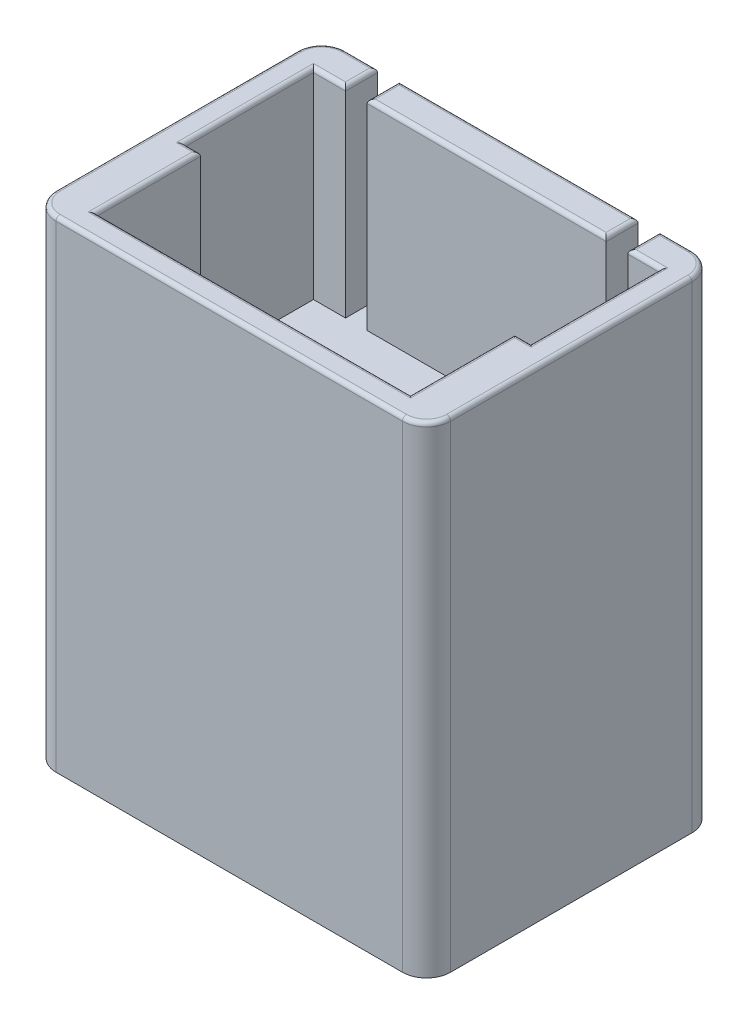
from build123d import *

# Parameters (mm, degrees)
EXTRUDE_1_DEPTH      = 25
SKETCH_1_W           = 29.8
SKETCH_1_H           = 4
EXTRUDE_1_2_DEPTH    = 25
SKETCH_2_W           = 49.2
SKETCH_2_H           = 36.1
EXTRUDE_2_DEPTH      = 5
SKETCH_4_W           = 6
SKETCH_4_H           = 6
CUT_EXTRUDE_1_DEPTH  = 1.5
SKETCH_5_W           = 6
SKETCH_5_H           = 13
CUT_EXTRUDE_2_DEPTH  = 5.5
SKETCH_6_W           = 20
SKETCH_6_H           = 10
CUT_EXTRUDE_3_DEPTH  = 5.5
SKETCH_11_W          = 6.036428748
SKETCH_11_H          = 14.5
CUT_EXTRUDE_10_DEPTH = 38
SKETCH_12_W          = 49.2
SKETCH_12_H          = 36.1
SKETCH_12_W_2        = 6.036428748
SKETCH_12_H_2        = 14.5
SKETCH_12_W_3        = 20
SKETCH_12_H_3        = 10
EXTRUDE_3_DEPTH      = 30
SKETCH_13_W          = 20
SKETCH_13_H          = 3
EXTRUDE_4_DEPTH      = 3
SKETCH_14_W          = 8
SKETCH_14_H          = 7.841140532
CUT_EXTRUDE_11_DEPTH = 20
FILLET_1_R           = 3
FILLET_2_R           = 0.5


with BuildPart() as part:
    # 草图1 → 凸台-拉伸1 (new body)
    with BuildSketch(Plane(origin=(0, 0, 0), x_dir=(1, 0, 0), z_dir=(0, 1, 0))):
        Polygon((-21.6, -8.1), (-21.6, 8), (-17.6, 8), (-17.6, 12), (-24.6, 12), (-24.6, -24.1), (24.6, -24.1), (24.6, 12), (17.6, 12), (17.6, 8), (21.6, 8), (21.6, -8.1), (19.6, -8.1), (19.6, -21.1), (-19.6, -21.1), (-19.6, -8.1), align=None)
    extrude(amount=EXTRUDE_1_DEPTH)



with BuildPart() as body_2:
    # 草图1 → Extrude 1 2 (new body)
    with BuildSketch(Plane(origin=(0, 0, 0), x_dir=(1, 0, 0), z_dir=(0, 1, 0))):
        with Locations((0, 10)):
            Rectangle(SKETCH_1_W, SKETCH_1_H)
    extrude(amount=EXTRUDE_1_2_DEPTH)


with BuildPart() as part_1:
    add(part.part)

    add(body_2.part)  # 凸台-拉伸2 merges body 2
    # 草图2 → 凸台-拉伸2 (add)
    with BuildSketch(Plane.XZ):
        with Locations((0, 6.05)):
            Rectangle(SKETCH_2_W, SKETCH_2_H)
    extrude(amount=EXTRUDE_2_DEPTH)

    # 草图4 → 切除-拉伸1 (cut)
    with BuildSketch(Plane(origin=(0, 0, 21.1), x_dir=(-1, 0, 0), z_dir=(0, 0, -1))):
        with Locations((-0.080282045, 3)):
            Rectangle(SKETCH_4_W, SKETCH_4_H)
    extrude(amount=-CUT_EXTRUDE_1_DEPTH, mode=Mode.SUBTRACT)

    # 草图5 → 切除-拉伸2 (cut)
    with BuildSketch(Plane(origin=(0, 0, 0), x_dir=(1, 0, 0), z_dir=(0, 1, 0))):
        with Locations((0.080282045, -14.6)):
            Rectangle(SKETCH_5_W, SKETCH_5_H)
    extrude(amount=-CUT_EXTRUDE_2_DEPTH, mode=Mode.SUBTRACT)

    # 草图6 → 切除-拉伸3 (cut)
    with BuildSketch(Plane(origin=(0, 0, 0), x_dir=(1, 0, 0), z_dir=(0, 1, 0))):
        with Locations((9.6, -0.585397149)):
            Rectangle(SKETCH_6_W, SKETCH_6_H)
    extrude(amount=-CUT_EXTRUDE_3_DEPTH, mode=Mode.SUBTRACT)

    # 草图11 → 切除-拉伸10 (cut)
    with BuildSketch(Plane(origin=(0, 0, 0), x_dir=(1, 0, 0), z_dir=(0, 1, 0))):
        with Locations((0.098496419, -15.35)):
            Rectangle(SKETCH_11_W, SKETCH_11_H)
    extrude(amount=-CUT_EXTRUDE_10_DEPTH, mode=Mode.SUBTRACT)

    # 草图12 → 凸台-拉伸3 (add)
    with BuildSketch(Plane.XZ.offset(5)):
        with Locations((0, 6.05)):
            Rectangle(SKETCH_12_W, SKETCH_12_H)
        with Locations((0.098496419, 15.35)):
            Rectangle(SKETCH_12_W_2, SKETCH_12_H_2, mode=Mode.SUBTRACT)
        with Locations((9.6, 0.585397149)):
            Rectangle(SKETCH_12_W_3, SKETCH_12_H_3, mode=Mode.SUBTRACT)
    extrude(amount=EXTRUDE_3_DEPTH)

    # 草图13 → 凸台-拉伸4 (add)
    with BuildSketch(Plane.XZ.offset(35)):
        with Locations((9.6, -2.914602851)):
            Rectangle(SKETCH_13_W, SKETCH_13_H)
    extrude(amount=-EXTRUDE_4_DEPTH)

    # 草图14 → 切除-拉伸11 (cut)
    with BuildSketch(Plane.XZ.offset(35)):
        Rectangle(SKETCH_14_W, SKETCH_14_H)
    extrude(amount=-CUT_EXTRUDE_11_DEPTH, mode=Mode.SUBTRACT)

    # 圆角1
    fillet_1_edges = [part_1.edges().sort_by_distance(p)[0] for p in [
        (24.6, -5, -12),
        (24.6, -5, 24.1),
        (-24.6, -5, 24.1),
        (-24.6, -5, -12),
    ]]
    fillet(fillet_1_edges, radius=FILLET_1_R)

    # 圆角2
    fillet_2_edges = [part_1.edges().sort_by_distance(p)[0] for p in [
        (23.721320344, 25, 23.221320344),
        (0, 25, 24.1),
        (-23.721320344, 25, 23.221320344),
        (-24.6, 25, 6.05),
        (-23.721320344, 25, -11.121320344),
        (-19.6, 25, -12),
        (-17.6, 25, -10),
        (-19.6, 25, -8),
        (-21.6, 25, 0.05),
        (-20.6, 25, 8.1),
        (-19.6, 25, 14.6),
        (0, 25, 21.1),
        (19.6, 25, 14.6),
        (20.6, 25, 8.1),
        (21.6, 25, 0.05),
        (19.6, 25, -8),
        (17.6, 25, -10),
        (19.6, 25, -12),
        (23.721320344, 25, -11.121320344),
        (24.6, 25, 6.05),
        (-14.9, 25, -10),
        (14.9, 25, -10),
        (0, 25, -8),
        (0, 25, -12),
    ]]
    fillet(fillet_2_edges, radius=FILLET_2_R)


solid = part_1.part
